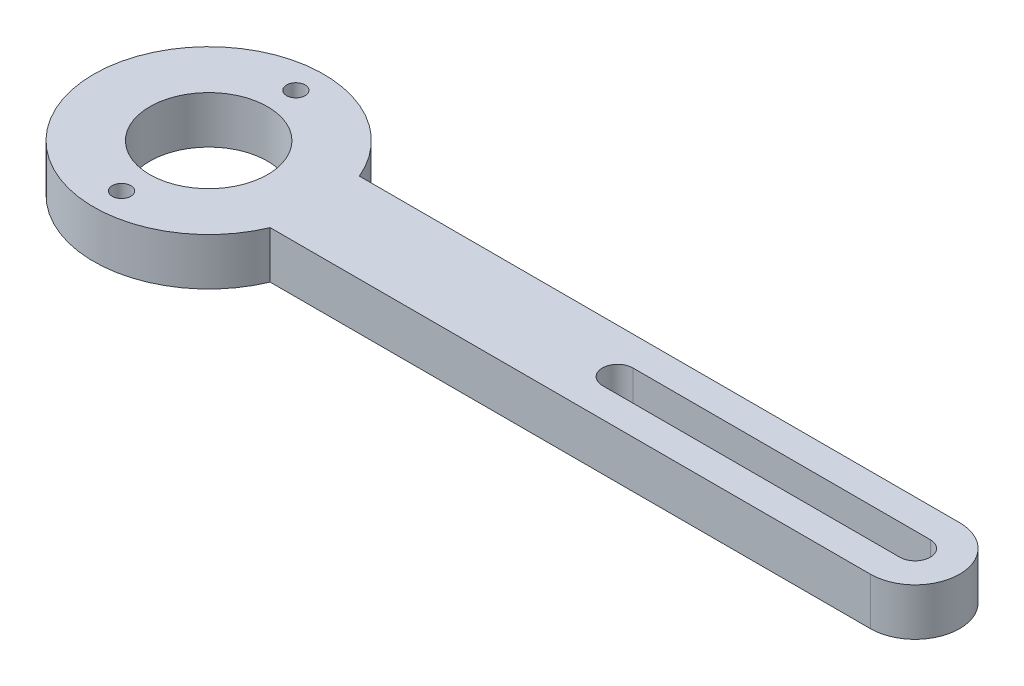
from build123d import *

# Parameters (mm, degrees)
SKETCH1_R           = 7.92
SKETCH1_R_2         = 1.25
BOSS_EXTRUDE1_DEPTH = 6.35


with BuildPart() as part:
    # Sketch1 → Boss-Extrude1 (new body)
    with BuildSketch(Plane(origin=(0, 0, 0), x_dir=(1, 0, 0), z_dir=(0, 1, 0))):
        with BuildLine():
            Line((14.264488249, 6), (95, 6))
            ThreePointArc((95, 6), (101, 0), (95, -6))
            Line((95, -6), (14.264488249, -6))
            ThreePointArc((14.264488249, -6), (-15.475, 0), (14.264488249, 6))
        make_face()
        Circle(SKETCH1_R, mode=Mode.SUBTRACT)
        with Locations((0, -11.725)):
            Circle(SKETCH1_R_2, mode=Mode.SUBTRACT)
        with Locations((0, 11.725)):
            Circle(SKETCH1_R_2, mode=Mode.SUBTRACT)
        with BuildLine():
            Line((55, 2.05), (95, 2.05))
            ThreePointArc((95, 2.05), (97.05, 0), (95, -2.05))
            Line((95, -2.05), (55, -2.05))
            ThreePointArc((55, -2.05), (52.95, 0), (55, 2.05))
        make_face(mode=Mode.SUBTRACT)
    extrude(amount=BOSS_EXTRUDE1_DEPTH)


solid = part.part
